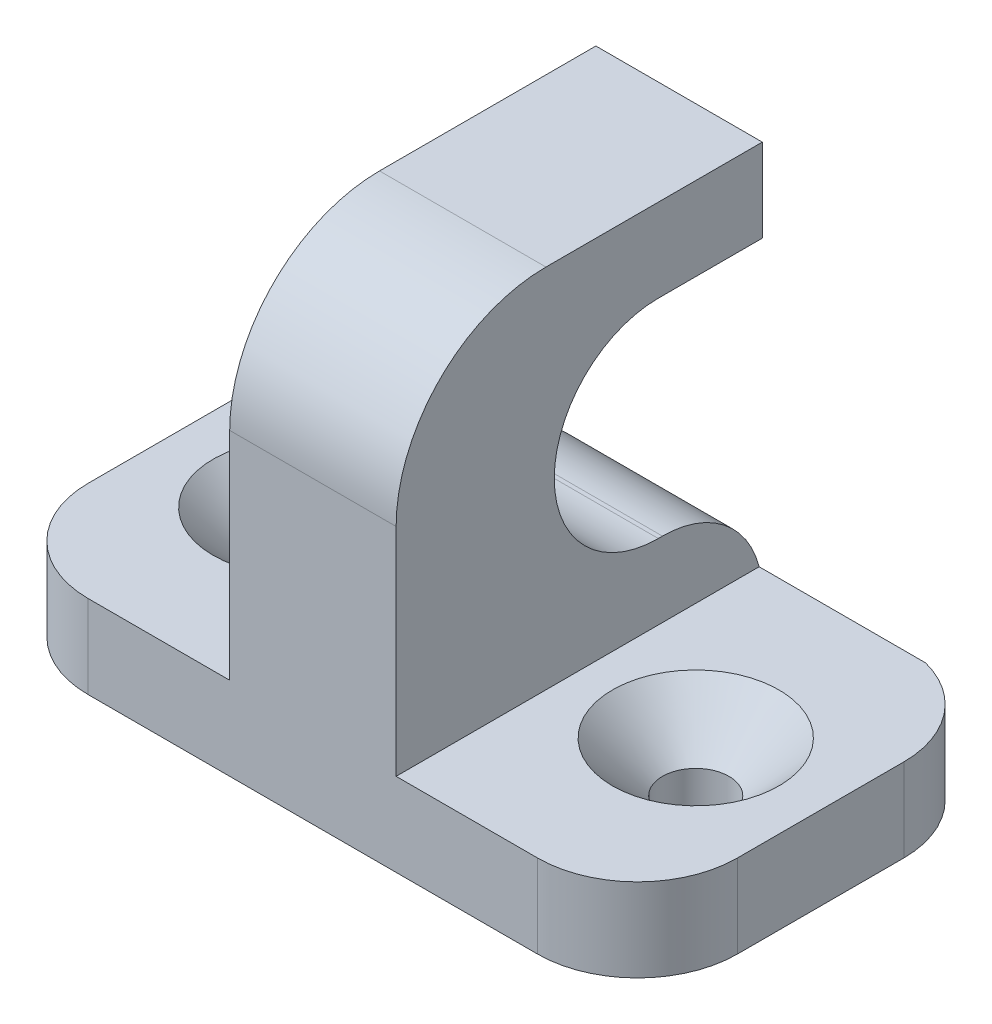
from build123d import *

# Parameters (mm, degrees)
SKETCH1_W           = 39
SKETCH1_H           = 22
BOSS_EXTRUDE1_DEPTH = 5
SKETCH2_W           = 10
SKETCH2_H           = 22
BOSS_EXTRUDE2_DEPTH = 22
SKETCH3_W           = 10
SKETCH3_H           = 12.5
CUT_EXTRUDE1_DEPTH  = 12.5
FILLET1_R           = 6.25
FILLET2_R           = 6
FILLET3_R           = 9
SKETCH5_R           = 2
CUT_EXTRUDE3_DEPTH  = 32.388692231
FILLET4_R           = 6
CHAMFER4_SIZE       = 3


# Some blends are built 0.0001 mm under size
with BuildPart() as part:
    # Sketch1 → Boss-Extrude1 (new body)
    with BuildSketch(Plane(origin=(0, 0, 0), x_dir=(1, 0, 0), z_dir=(0, 1, 0))):
        Rectangle(SKETCH1_W, SKETCH1_H)
    extrude(amount=BOSS_EXTRUDE1_DEPTH)

    # Sketch2 → Boss-Extrude2 (add)
    with BuildSketch(Plane(origin=(0, 5, 0), x_dir=(1, 0, 0), z_dir=(0, 1, 0))):
        Rectangle(SKETCH2_W, SKETCH2_H)
    extrude(amount=BOSS_EXTRUDE2_DEPTH)

    # Sketch3 → Cut-Extrude1 (cut)
    with BuildSketch(Plane(origin=(0, 0, -11), x_dir=(-1, 0, 0), z_dir=(0, 0, -1))):
        with Locations((0, 15.75)):
            Rectangle(SKETCH3_W, SKETCH3_H)
    extrude(amount=-CUT_EXTRUDE1_DEPTH, mode=Mode.SUBTRACT)

    # Fillet1
    fillet1_edges = [part.edges().sort_by_distance(p)[0] for p in [
        (0, 22, 1.5),
        (0, 9.5, 1.5),
    ]]
    fillet(fillet1_edges, radius=FILLET1_R - 0.0001)  # a hair under: the kernel refuses the full size

    # Fillet2
    fillet2_edges = [part.edges().sort_by_distance(p)[0] for p in [
        (-19.5, 2.5, -11),
        (19.5, 2.5, -11),
        (19.5, 2.5, 11),
        (-19.5, 2.5, 11),
    ]]
    fillet(fillet2_edges, radius=FILLET2_R)

    # Fillet3
    fillet3_edges = [part.edges().sort_by_distance(p)[0] for p in [
        (0, 27, 11),
    ]]
    fillet(fillet3_edges, radius=FILLET3_R)

    # Sketch5 → Cut-Extrude3 (cut, through all)
    with BuildSketch(Plane(origin=(0, 5, 0), x_dir=(1, 0, 0), z_dir=(0, 1, 0))):
        with Locations(Location((-12, 0, 0), (0, 0, 270))):
            Circle(SKETCH5_R)
        with Locations(Location((12, 0, 0), (0, 0, 270))):
            Circle(SKETCH5_R)
    extrude(amount=-CUT_EXTRUDE3_DEPTH, mode=Mode.SUBTRACT)

    # Fillet4
    # the kernel refuses this fillet: 6 mm, written as the material it takes off along each edge
    with BuildSketch(Plane(origin=(-20, 9.5, -11), x_dir=(0, -1, 0), z_dir=(1, 0, 0))) as fillet4_piece_1:
        with BuildLine():
            CenterArc((FILLET4_R, -FILLET4_R), FILLET4_R, 90, 90)
            Line((0, -FILLET4_R), (0, 0))
            Line((0, 0), (FILLET4_R, 0))
        make_face()
    extrude(amount=40, mode=Mode.SUBTRACT)

    # Chamfer4
    chamfer4_edges = [part.edges().sort_by_distance(p)[0] for p in [
        (-12, 5, -2),
        (12, 5, -2),
    ]]
    chamfer(chamfer4_edges, length=CHAMFER4_SIZE)


solid = part.part
